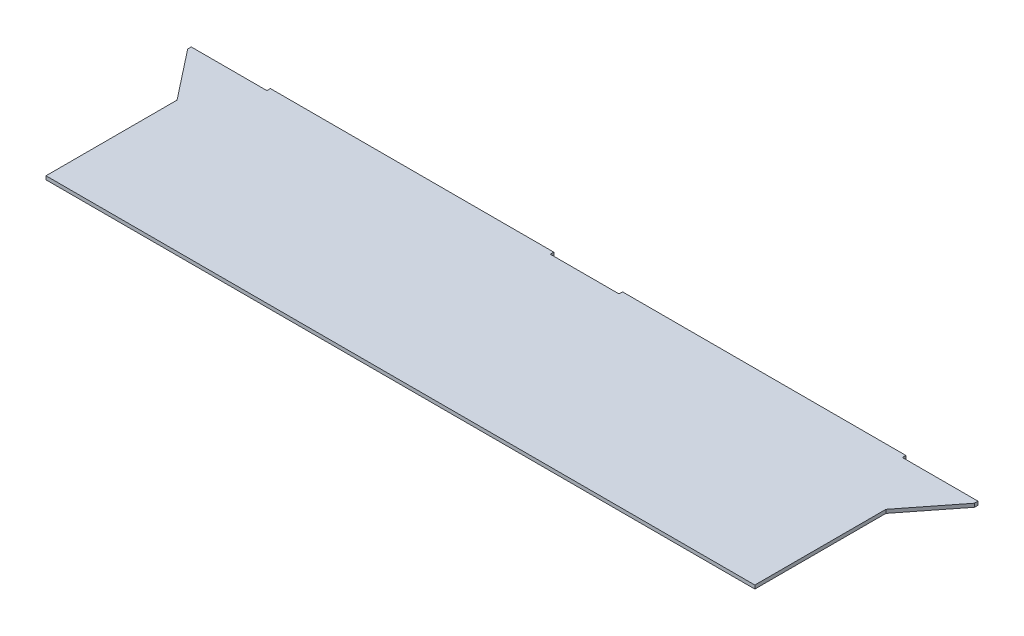
from build123d import *

# Parameters (mm, degrees)
SKETCH1_W           = 635.3556
SKETCH1_H           = 165.1
BOSS_EXTRUDE1_DEPTH = 1.5875
SKETCH2_W           = 254
SKETCH2_H           = 3.175
BOSS_EXTRUDE2_DEPTH = 3.175
BOSS_EXTRUDE3_DEPTH = 3.175


with BuildPart() as part:
    # Sketch1 → Boss-Extrude1 (new, symmetric)
    with BuildSketch(Plane(origin=(0, 0, 0), x_dir=(1, 0, 0), z_dir=(0, 1, 0))):
        Rectangle(SKETCH1_W, SKETCH1_H)
    extrude(amount=BOSS_EXTRUDE1_DEPTH, both=True)

    # Sketch2 → Boss-Extrude2 (add)
    with BuildSketch(Plane(origin=(0, 0, -82.55), x_dir=(-1, 0, 0), z_dir=(0, 0, -1))):
        with Locations((-157.8229, 0)):
            Rectangle(SKETCH2_W, SKETCH2_H)
        with Locations((157.8229, 0)):
            Rectangle(SKETCH2_W, SKETCH2_H)
    extrude(amount=BOSS_EXTRUDE2_DEPTH)

    # Sketch3 → Boss-Extrude3 (add)
    with BuildSketch(Plane.XZ.offset(1.5875)):
        Polygon((317.6778, -82.55), (352.6028, -82.55), (352.6028, -79.375), (317.6778, -34.925), align=None)
    boss_extrude3 = extrude(amount=-BOSS_EXTRUDE3_DEPTH)

    # Mirror1: Boss-Extrude3 across plane
    add(boss_extrude3.mirror(Plane(origin=(0, 0, 0), x_dir=(0, 0, 1), z_dir=(1, 0, 0))))


solid = part.part
